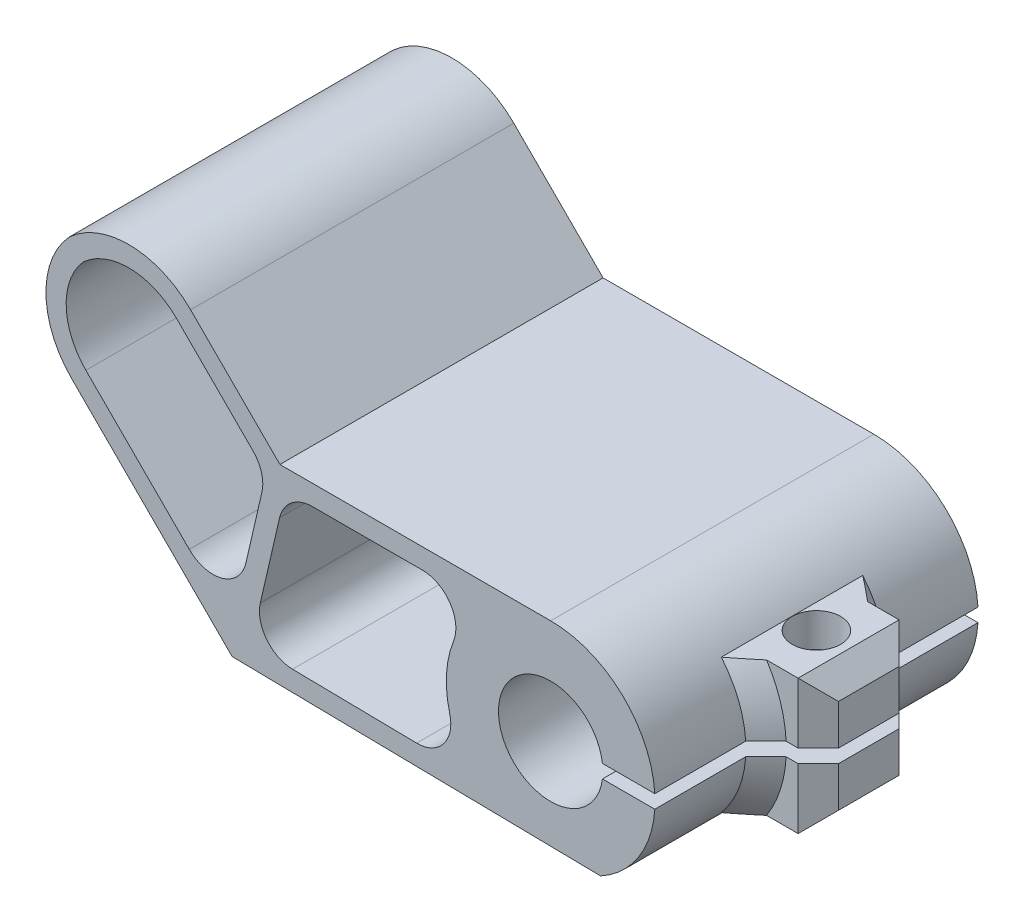
from build123d import *

# Parameters (mm, degrees)
SKETCH1_R                    = 7.75
BOSS_EXTRUDE1_DEPTH          = 48
CUT_EXTRUDE1_START           = -38
CUT_EXTRUDE1_DEPTH           = 38
CUT_EXTRUDE2_DEPTH           = 2
CUT_EXTRUDE2_DEPTH_BACK      = 2
SKETCH17_W                   = 125.861359887
SKETCH17_H                   = 127.556512283
EXTRUDE_THIN1_DEPTH          = 38
FILLET1_R                    = 10
FILLET2_R                    = 13
EXTRUDE_THIN2_DEPTH          = 38
FILLET3_R                    = 5
CHAMFER1_SIZE                = 3
FILLET4_R                    = 3
SKETCH20_W                   = 15.564990448
SKETCH20_H                   = 15
BOSS_EXTRUDE3_DEPTH          = 10
CUT_EXTRUDE_THIN2_DEPTH      = 95.788643218
CUT_EXTRUDE_THIN2_DEPTH_BACK = 63
SKETCH15_W                   = 30.528675624
SKETCH15_H                   = 2
CUT_EXTRUDE3_DEPTH           = 96.136919394
CUT_EXTRUDE3_DEPTH_BACK      = 96.136919394
SKETCH21_R                   = 2.25
SKETCH22_R                   = 3.6
CUT_EXTRUDE4_DEPTH           = 5
CUT_EXTRUDE5_DEPTH           = 5
CHAMFER2_SIZE                = 3
CHAMFER3_SIZE                = 3


# Read off the part's stored shape, not the designer's step: Cut-Extrude1
with BuildPart() as part:
    # Sketch1 → Boss-Extrude1 (new body)
    with BuildSketch(Plane.XY):
        with BuildLine():
            Line((0, 15.5), (-30, 15.5))
            Line((-30, 15.5), (-40.214839435, 15.5))
            Line((-40.214839435, 15.5), (-62.672890113, 37.958050678))
            Line((-62.672890113, 37.958050678), (-80.350559642, 20.280381148))
            Line((-80.350559642, 20.280381148), (-45.035089247, -15.035089247))
            Line((-45.035089247, -15.035089247), (-29.535089247, -15.035089247))
            Line((-29.535089247, -15.035089247), (0, -15.5))
            ThreePointArc((0, -15.5), (10.960155108, -10.960155108), (15.5, 0))
            ThreePointArc((15.5, 0), (10.960155108, 10.960155108), (0, 15.5))
        make_face()
        Circle(SKETCH1_R, mode=Mode.SUBTRACT)
        with BuildLine():
            Line((-31, 3.25), (-29, 3.25))
            ThreePointArc((-29, 3.25), (-25.75, 0), (-29, -3.25))
            Line((-29, -3.25), (-31, -3.25))
            ThreePointArc((-31, -3.25), (-34.25, 0), (-31, 3.25))
        make_face(mode=Mode.SUBTRACT)
        with BuildLine():
            Line((-60.386222858, 22.589907971), (-58.972009295, 21.175694409))
            ThreePointArc((-58.972009295, 21.175694409), (-58.972009295, 16.579500331), (-63.568203373, 16.579500331))
            Line((-63.568203373, 16.579500331), (-64.982416935, 17.993713893))
            ThreePointArc((-64.982416935, 17.993713893), (-64.982416935, 22.589907971), (-60.386222858, 22.589907971))
        make_face(mode=Mode.SUBTRACT)
    extrude(amount=BOSS_EXTRUDE1_DEPTH)

    # Cut-Extrude1 outline → Cut-Extrude1 (cut)
    with BuildSketch(Plane.XY.offset(48).offset(CUT_EXTRUDE1_START)):
        with BuildLine():
            Line((-29.535089247, -15.035089247), (-0.487848981, -15.492320787))
            ThreePointArc((-0.487848981, -15.492320787), (-15.498080073, 0.243954708), (0, 15.5))
            Line((0, 15.5), (-40.214839435, 15.5))
            Line((-40.214839435, 15.5), (-62.672890113, 37.958050678))
            Line((-62.672890113, 37.958050678), (-80.350559642, 20.280381148))
            Line((-80.350559642, 20.280381148), (-45.035089247, -15.035089247))
            Line((-45.035089247, -15.035089247), (-29.535089247, -15.035089247))
        make_face()
        with BuildLine():
            Line((-29, -3.25), (-31, -3.25))
            ThreePointArc((-31, -3.25), (-34.25, 0), (-31, 3.25))
            Line((-31, 3.25), (-29, 3.25))
            ThreePointArc((-29, 3.25), (-25.75, 0), (-29, -3.25))
        make_face(mode=Mode.SUBTRACT)
        with BuildLine():
            Line((-63.568203373, 16.579500331), (-64.982416935, 17.993713893))
            ThreePointArc((-64.982416935, 17.993713893), (-64.982416935, 22.589907971), (-60.386222858, 22.589907971))
            Line((-60.386222858, 22.589907971), (-58.972009295, 21.175694409))
            ThreePointArc((-58.972009295, 21.175694409), (-58.972009295, 16.579500331), (-63.568203373, 16.579500331))
        make_face(mode=Mode.SUBTRACT)
    extrude(amount=CUT_EXTRUDE1_DEPTH, mode=Mode.SUBTRACT)

    # Sketch17 → Cut-Extrude2 (cut, two sides: drawn at the far end of the back side and taken through both)
    with BuildSketch(Plane(origin=(-0.243924491, -15.496160394, 0), x_dir=(-0.999876134056697, 0.015739013432683965, 0), z_dir=(-0.015739013432683965, -0.999876134056697, 0)).offset(-CUT_EXTRUDE2_DEPTH_BACK)):
        with Locations((29.523320042, -28.408716393)):
            Rectangle(SKETCH17_W, SKETCH17_H)
    extrude(amount=CUT_EXTRUDE2_DEPTH + CUT_EXTRUDE2_DEPTH_BACK, mode=Mode.SUBTRACT)

    # Sketch18 → Extrude-Thin1 (add)
    with BuildSketch(Plane.XY.offset(10)):
        Polygon((0, 15.5), (-40.214839435, 15.5), (-62.672890113, 37.958050678), (-80.350559642, 20.280381148), (-47.315213288, -12.754965206), (-7.830678136, -13.376489821), (-7.783461096, -10.376861419), (-46.053077004, -9.774460803), (-76.107918955, 20.280381148), (-62.672890113, 33.715409991), (-41.457480122, 12.5), (0, 12.5), align=None)
    extrude(amount=EXTRUDE_THIN1_DEPTH)

    # Fillet1
    # the kernel refuses this fillet: 10 mm, written as the material it adds along each edge
    with BuildSketch(Plane(origin=(-76.107918955, 20.280381148, 10), x_dir=(0.7071067811865474, 0.7071067811865477, 0), z_dir=(0, 0, 1)), Plane(origin=(-62.672890113, 33.715409991, 10), x_dir=(0.7071067811865476, -0.7071067811865476, 0), z_dir=(0, 0, 1))) as fillet1_piece_1:
        with BuildLine():
            CenterArc((FILLET1_R, -FILLET1_R), FILLET1_R, 90, 90)
            Line((0, -FILLET1_R), (0, 0))
            Line((0, 0), (FILLET1_R, 0))
        make_face()
    extrude(amount=38)

    # Fillet2
    # the kernel refuses this fillet: 13 mm, written as the material it takes off along each edge
    with BuildSketch(Plane(origin=(-80.350559642, 20.280381148, 80.5), x_dir=(0.7071067811865474, 0.7071067811865477, 0), z_dir=(0, 0, -1))) as fillet2_piece_1:
        with BuildLine():
            CenterArc((FILLET2_R, FILLET2_R), FILLET2_R, 180, 90)
            Line((0, FILLET2_R), (0, 0))
            Line((0, 0), (FILLET2_R, 0))
        make_face()
    extrude(amount=113, mode=Mode.SUBTRACT)
    with BuildSketch(Plane(origin=(-62.672890113, 37.958050678, -32.5), x_dir=(0.707106781186548, -0.7071067811865471, 0), z_dir=(0, 0, 1))) as fillet2_piece_2:
        with BuildLine():
            CenterArc((FILLET2_R, -FILLET2_R), FILLET2_R, 90, 90)
            Line((0, -FILLET2_R), (0, 0))
            Line((0, 0), (FILLET2_R, 0))
        make_face()
    extrude(amount=113, mode=Mode.SUBTRACT)

    # Sketch19 → Extrude-Thin2 (add)
    with BuildSketch(Plane.XY.offset(48)):
        Polygon((-41.676354362, 15.83760053), (-47.514591931, -9.436860273), (-44.591562077, -10.112061333), (-38.753324508, 15.16239947), align=None)
    extrude(amount=-EXTRUDE_THIN2_DEPTH)

    # Fillet3
    fillet3_edges = [part.edges().sort_by_distance(p)[0] for p in [
        (-9.165151385, 12.5, 29),
        (-11.56733894, -10.317299537, 29),
        (-47.303691572, -8.523846235, 29),
        (-44.51915596, -9.798606198, 29),
        (-39.368321628, 12.5, 29),
        (-42.261577308, 13.304097186, 29),
    ]]
    fillet(fillet3_edges, radius=FILLET3_R)

    # Chamfer1
    # the kernel refuses this chamfer: 3 mm, written as the material it adds along each edge
    with BuildSketch(Plane(origin=(-53.68106853, -2.146469277, 10), x_dir=(-0.019442520806014586, -0.01944252080601459, 0.9996219169112968), z_dir=(-0.7071067811865476, 0.7071067811865475, 0))) as chamfer1_piece_1:
        Polygon((CHAMFER1_SIZE * 0.999621916911, CHAMFER1_SIZE * 0.0274958766106), (-CHAMFER1_SIZE * 0.0274958766106, CHAMFER1_SIZE * 0.999621916911), (0, 0), align=None)
    extrude(amount=21.716356033)
    with BuildSketch(Plane(origin=(-62.672890113, 19.573274367, 10), x_dir=(0.7071067811865476, 0.7071067811865476, 0), z_dir=(0.7071067811865476, -0.7071067811865476, 0))) as chamfer1_piece_2:
        Polygon((10, CHAMFER1_SIZE), (10 - CHAMFER1_SIZE, 0), (10, 0), align=None)
    revolve(axis=Axis((-62.672890113, 19.573274367, 10), (0, 0, 1)), revolution_arc=131.354634341)
    with BuildSketch(Plane(origin=(-61.965783332, 20.280381148, 10), x_dir=(-0.06358071748062528, 0.9979766993094824, 0), z_dir=(0.9979766993094824, 0.06358071748062528, 0))) as chamfer1_piece_3:
        Polygon((10, CHAMFER1_SIZE), (10 - CHAMFER1_SIZE, 0), (10, 0), align=None)
    revolve(axis=Axis((-61.965783332, 20.280381148, 10), (0, 0, 1)), revolution_arc=131.354634341)
    with BuildSketch(Plane(origin=(-42.885448285, 10.603281677, 10), x_dir=(0.026790422734602474, -0.006188415005949584, 0.9996219169112968), z_dir=(-0.225067019815147, -0.9743432847777668, 0))) as chamfer1_piece_4:
        Polygon((CHAMFER1_SIZE * 0.999621916911, CHAMFER1_SIZE * 0.0274958766106), (-CHAMFER1_SIZE * 0.0274958766106, CHAMFER1_SIZE * 0.999621916911), (0, 0), align=None)
    extrude(amount=10.611816501)
    with BuildSketch(Plane(origin=(-55.601822301, 26.644342179, 10), x_dir=(0.01944252080601379, 0.019442520806013806, 0.9996219169112968), z_dir=(0.7071067811865479, -0.7071067811865472, 0))) as chamfer1_piece_5:
        Polygon((CHAMFER1_SIZE * 0.999621916911, CHAMFER1_SIZE * 0.0274958766106), (-CHAMFER1_SIZE * 0.0274958766106, CHAMFER1_SIZE * 0.999621916911), (0, 0), align=None)
    extrude(amount=16.094021158)
    with BuildSketch(Plane(origin=(-47.757164709, 11.728616776, 10), x_dir=(0.7071067811865476, 0.7071067811865476, 0), z_dir=(-0.7071067811865476, 0.7071067811865476, 0))) as chamfer1_piece_6:
        Polygon((5, -CHAMFER1_SIZE), (5 - CHAMFER1_SIZE, 0), (5, 0), align=None)
    revolve(axis=Axis((-47.757164709, 11.728616776, 10), (0, 0, -1)), revolution_arc=58.006819199)
    with BuildSketch(Plane(origin=(-50.145534624, 1.389064629, 10), x_dir=(0.9743432847777667, -0.22506701981514685, 0), z_dir=(0.22506701981514685, 0.9743432847777667, 0))) as chamfer1_piece_7:
        Polygon((5, -CHAMFER1_SIZE), (5 - CHAMFER1_SIZE, 0), (5, 0), align=None)
    revolve(axis=Axis((-50.145534624, 1.389064629, 10), (0, 0, -1)), revolution_arc=121.993180801)
    with BuildSketch(Plane(origin=(-19.911735458, -10.185950698, 10), x_dir=(-0.000432757971317445, -0.02749247080789303, 0.9996219169112968), z_dir=(-0.999876134056697, 0.015739013432684173, 0))) as chamfer1_piece_8:
        Polygon((CHAMFER1_SIZE * 0.999621916911, CHAMFER1_SIZE * 0.0274958766106), (-CHAMFER1_SIZE * 0.0274958766106, CHAMFER1_SIZE * 0.999621916911), (0, 0), align=None)
    extrude(amount=18.424401561)
    with BuildSketch(Plane(origin=(-43.12687622, -3.771253025, 10), x_dir=(-0.026790422734602474, 0.006188415005949584, 0.9996219169112968), z_dir=(0.225067019815147, 0.9743432847777668, 0))) as chamfer1_piece_9:
        Polygon((CHAMFER1_SIZE * 0.999621916911, CHAMFER1_SIZE * 0.0274958766106), (-CHAMFER1_SIZE * 0.0274958766106, CHAMFER1_SIZE * 0.999621916911), (0, 0), align=None)
    extrude(amount=12.723019)
    with BuildSketch(Plane(origin=(-35.391627827, 12.5, 10), x_dir=(0, 0.027495876610586206, 0.9996219169112968), z_dir=(1, 0, 0))) as chamfer1_piece_10:
        Polygon((CHAMFER1_SIZE * 0.999621916911, CHAMFER1_SIZE * 0.0274958766106), (-CHAMFER1_SIZE * 0.0274958766106, CHAMFER1_SIZE * 0.999621916911), (0, 0), align=None)
    extrude(amount=16.312843803)
    with BuildSketch(Plane(origin=(5e-09, 0, 10), x_dir=(-0.9674653851631903, -0.25300341600666165, 0), z_dir=(0.25300341600666165, -0.9674653851631903, 0))) as chamfer1_piece_11:
        Polygon((15.5, -CHAMFER1_SIZE), (15.5 + CHAMFER1_SIZE, 0), (15.5, 0), align=None)
    revolve(axis=Axis((5e-09, 0, 10), (0, 0, -1)), revolution_arc=36.115438071)
    with BuildSketch(Plane(origin=(-35.391627827, 7.5, 10), x_dir=(-0.9743432847777669, 0.22506701981514626, 0), z_dir=(-0.22506701981514626, -0.9743432847777669, 0))) as chamfer1_piece_12:
        Polygon((5, -CHAMFER1_SIZE), (5 - CHAMFER1_SIZE, 0), (5, 0), align=None)
    revolve(axis=Axis((-35.391627827, 7.5, 10), (0, 0, -1)), revolution_arc=76.993180801)
    with BuildSketch(Plane(origin=(-19.078784023, 7.5, 10), x_dir=(0.9306723916262207, -0.3658536585367573, 0), z_dir=(-0.3658536585367573, -0.9306723916262207, 0))) as chamfer1_piece_13:
        Polygon((5, CHAMFER1_SIZE), (5 - CHAMFER1_SIZE, 0), (5, 0), align=None)
    revolve(axis=Axis((-19.078784023, 7.5, 10), (0, 0, 1)), revolution_arc=111.460127749)
    with BuildSketch(Plane(origin=(-19.833040391, -5.186570028, 10), x_dir=(0.9674653851631903, 0.25300341600666165, 0), z_dir=(-0.25300341600666165, 0.9674653851631903, 0))) as chamfer1_piece_14:
        Polygon((5, -CHAMFER1_SIZE), (5 - CHAMFER1_SIZE, 0), (5, 0), align=None)
    revolve(axis=Axis((-19.833040391, -5.186570028, 10), (0, 0, -1)), revolution_arc=105.5571266)
    with BuildSketch(Plane(origin=(-38.255159796, -4.896588124, 10), x_dir=(-0.0157390134326846, -0.9998761340566968, 0), z_dir=(0.9998761340566968, -0.0157390134326846, 0))) as chamfer1_piece_15:
        Polygon((5, -CHAMFER1_SIZE), (5 - CHAMFER1_SIZE, 0), (5, 0), align=None)
    revolve(axis=Axis((-38.255159796, -4.896588124, 10), (0, 0, -1)), revolution_arc=102.105002921)

    # Fillet4
    fillet4_edges = [part.edges().sort_by_distance(p)[0] for p in [
        (-19.95471404, -13.185645818, 0),
    ]]
    fillet(fillet4_edges, radius=FILLET4_R)

    # Sketch20 → Boss-Extrude3 (add, symmetric)
    with BuildSketch(Plane(origin=(0, 0, 0), x_dir=(1, 0, 0), z_dir=(0, 1, 0))):
        with Locations((15.467708298, -24)):
            Rectangle(SKETCH20_W, SKETCH20_H)
    extrude(amount=BOSS_EXTRUDE3_DEPTH, both=True)

    # Sketch15 → Cut-Extrude-Thin2 (cut, two sides: drawn at the far end of the back side and taken through both)
    with BuildSketch(Plane.XY.offset(48).offset(-CUT_EXTRUDE_THIN2_DEPTH_BACK)):
        with Locations((15.264337812, 0)):
            Rectangle(SKETCH15_W, SKETCH15_H)
    extrude(amount=CUT_EXTRUDE_THIN2_DEPTH + CUT_EXTRUDE_THIN2_DEPTH_BACK, mode=Mode.SUBTRACT)

    # Sketch21 → Cut-Extrude3 (cut, two sides: drawn at the far end of the back side and taken through both)
    with BuildSketch(Plane(origin=(0, -1, 0), x_dir=(1, 0, 0), z_dir=(0, 1, 0)).offset(-CUT_EXTRUDE3_DEPTH_BACK)):
        with Locations(Location((15.467708298, -24, 0), (0, 0, 270))):
            Circle(SKETCH21_R)
    extrude(amount=CUT_EXTRUDE3_DEPTH + CUT_EXTRUDE3_DEPTH_BACK, mode=Mode.SUBTRACT)

    # Sketch22 → Cut-Extrude4 (cut)
    with BuildSketch(Plane(origin=(0, 10, 0), x_dir=(1, 0, 0), z_dir=(0, 1, 0))):
        with Locations(Location((15.467708298, -24, 0), (0, 0, 270))):
            Circle(SKETCH22_R)
    extrude(amount=-CUT_EXTRUDE4_DEPTH, mode=Mode.SUBTRACT)

    # Sketch23 → Cut-Extrude5 (cut)
    with BuildSketch(Plane(origin=(0, -10, 0), x_dir=(-1, 0, 0), z_dir=(0, -1, 0))):
        Polygon((-19.624630236, -24), (-17.546169267, -27.6), (-13.389247329, -27.6), (-11.31078636, -24), (-13.389247329, -20.4), (-17.546169267, -20.4), align=None)
    extrude(amount=-CUT_EXTRUDE5_DEPTH, mode=Mode.SUBTRACT)

    # Chamfer2
    chamfer2_edges = [part.edges().sort_by_distance(p)[0] for p in [
        (23.250203522, 10, 24),
        (14.377581982, 5.790952974, 31.5),
        (23.250203522, -10, 24),
        (14.377581982, -5.790952974, 16.5),
        (14.377581982, 5.790952974, 16.5),
        (14.377581982, -5.790952974, 31.5),
    ]]
    chamfer(chamfer2_edges, length=CHAMFER2_SIZE)

    # Chamfer3
    chamfer3_edges = [part.edges().sort_by_distance(p)[0] for p in [
        (23.250203522, -4, 16.5),
        (23.250203522, 4, 16.5),
        (23.250203522, -4, 31.5),
        (23.250203522, 4, 31.5),
    ]]
    chamfer(chamfer3_edges, length=CHAMFER3_SIZE)


solid = part.part
